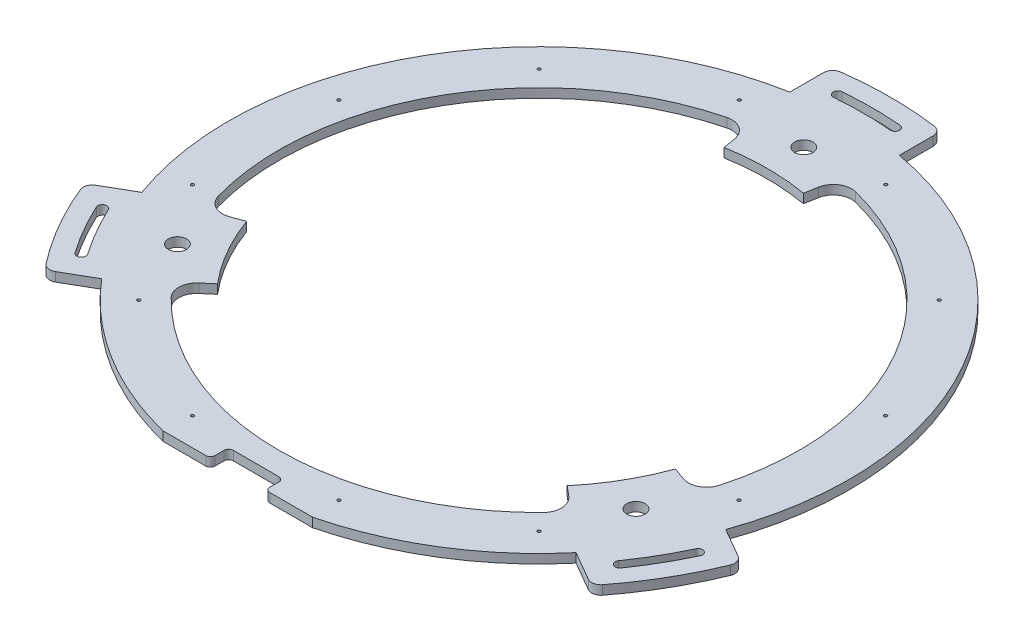
from build123d import *

# Parameters (mm, degrees)
SKETCH1_R                                       = 340
SKETCH1_R_2                                     = 250
BOSS_EXTRUDE1_DEPTH                             = 10
BOSS_EXTRUDE2_DEPTH                             = 10
CIRPATTERN1_COUNT                               = 3
CUT_EXTRUDE1_START                              = -10
CUT_EXTRUDE1_DEPTH                              = 10
CIRPATTERN2_COUNT                               = 3
CUT_EXTRUDE2_DEPTH                              = 10
SKETCH8_R                                       = 10
CUT_EXTRUDE3_DEPTH                              = 10
SKETCH9_W                                       = 60
SKETCH9_H                                       = 20
CUT_EXTRUDE4_DEPTH                              = 10
FILLET1_R                                       = 5
CSK_FOR_M3_FLAT_HEAD_MACHINE_SCREW1_D           = 3.4
CSK_FOR_M3_FLAT_HEAD_MACHINE_SCREW1_CSINK_D     = 6.3
CSK_FOR_M3_FLAT_HEAD_MACHINE_SCREW1_CSINK_ANGLE = 90


with BuildPart() as part:
    # Sketch1 → Boss-Extrude1 (new body)
    with BuildSketch(Plane(origin=(0, 0, 0), x_dir=(1, 0, 0), z_dir=(0, 1, 0))):
        Circle(SKETCH1_R)
        Circle(SKETCH1_R_2, mode=Mode.SUBTRACT)
    extrude(amount=BOSS_EXTRUDE1_DEPTH)

    # Sketch2 → Boss-Extrude2 (add)
    with BuildSketch(Plane.XZ):
        with BuildLine():
            Line((351.85982974, 133.864335114), (319.827534924, 115.37048108))
            ThreePointArc((319.827534924, 115.37048108), (294.448637287, 170), (259.827534924, 219.293529534))
            Line((259.827534924, 219.293529534), (291.85982974, 237.787383569))
            ThreePointArc((291.85982974, 237.787383569), (298.796843602, 238.937734879), (304.776091866, 235.237186318))
            ThreePointArc((304.776091866, 235.237186318), (333.419780457, 192.5), (356.109425199, 146.325244863))
            ThreePointArc((356.109425199, 146.325244863), (356.324570129, 139.29678969), (351.85982974, 133.864335114))
        make_face()
        with BuildLine():
            ThreePointArc((298.990496165, 209.355399268), (316.099272381, 182.5), (330.802342268, 154.255665535))
            ThreePointArc((330.802342268, 154.255665535), (328.383894642, 147.611035291), (321.739264398, 150.029482918))
            ThreePointArc((321.739264398, 150.029482918), (307.439018343, 177.5), (290.798975723, 203.619634905))
            ThreePointArc((290.798975723, 203.619634905), (292.026853762, 210.583277308), (298.990496165, 209.355399268))
        make_face(mode=Mode.SUBTRACT)
    boss_extrude2 = extrude(amount=-BOSS_EXTRUDE2_DEPTH)

    # CirPattern1: Boss-Extrude2 ×3 about axis
    cirpattern1_axis = Axis((0, 0, 0), (0, 1, 0))
    for i in range(1, CIRPATTERN1_COUNT):
        add(boss_extrude2.rotate(cirpattern1_axis, i * 360 / CIRPATTERN1_COUNT))

    # Sketch6 → Cut-Extrude1 (cut)
    with BuildSketch(Plane(origin=(0, 10, 0), x_dir=(1, 0, 0), z_dir=(0, 1, 0)).offset(CUT_EXTRUDE1_START)):
        with BuildLine():
            Line((234.923155198, -85.505035828), (248.308329746, -90.376840943))
            ThreePointArc((248.308329746, -90.376840943), (264.279563148, -89.377030612), (274.405240734, -76.985478228))
            ThreePointArc((274.405240734, -76.985478228), (246.817240076, 142.500000004), (70.53124049, 276.134648523))
            ThreePointArc((70.53124049, 276.134648523), (54.73700254, 273.561330695), (45.885524694, 260.229742004))
            Line((45.885524694, 260.229742004), (43.412044411, 246.201938254))
            ThreePointArc((43.412044411, 246.201938254), (191.511110778, 160.696902424), (250, 0))
            ThreePointArc((250, 0), (246.201938253, -43.412044415), (234.923155198, -85.505035828))
        make_face()
    cut_extrude1 = extrude(amount=CUT_EXTRUDE1_DEPTH, mode=Mode.SUBTRACT)

    # CirPattern2: Cut-Extrude1 ×3 about axis
    cirpattern2_axis = Axis((0, 0, 0), (0, 1, 0))
    for i in range(1, CIRPATTERN2_COUNT):
        add(cut_extrude1.rotate(cirpattern2_axis, i * 360 / CIRPATTERN2_COUNT), mode=Mode.SUBTRACT)

    # Sketch7 → Cut-Extrude2 (cut)
    with BuildSketch(Plane.XZ):
        with BuildLine():
            Line((-81.853527719, 330), (81.853527719, 330))
            ThreePointArc((81.853527719, 330), (0, 340), (-81.853527719, 330))
        make_face()
    extrude(amount=-CUT_EXTRUDE2_DEPTH, mode=Mode.SUBTRACT)

    # Sketch8 → Cut-Extrude3 (cut)
    with BuildSketch(Plane(origin=(0, 10, 0), x_dir=(1, 0, 0), z_dir=(0, 1, 0))):
        with Locations((0, 290)):
            Circle(SKETCH8_R)
        with Locations((251.147367097, -145)):
            Circle(SKETCH8_R)
        with Locations((-251.147367097, -145)):
            Circle(SKETCH8_R)
    extrude(amount=-CUT_EXTRUDE3_DEPTH, mode=Mode.SUBTRACT)

    # Sketch9 → Cut-Extrude4 (cut)
    with BuildSketch(Plane(origin=(0, 10, 0), x_dir=(1, 0, 0), z_dir=(0, 1, 0))):
        with Locations((0, -320)):
            Rectangle(SKETCH9_W, SKETCH9_H)
    extrude(amount=-CUT_EXTRUDE4_DEPTH, mode=Mode.SUBTRACT)

    # Fillet1
    fillet1_edges = [part.edges().sort_by_distance(p)[0] for p in [
        (30, 5, 330),
        (30, 5, 310),
        (-30, 5, 310),
        (-30, 5, 330),
    ]]
    fillet(fillet1_edges, radius=FILLET1_R)

    # CSK for M3 Flat Head Machine Screw1 (through all)
    with Locations(Plane(origin=(0, 40, 0), x_dir=(1, 0, 0), z_dir=(0, 1, 0))):
        with Locations((80.233903982, 299.43700615), (219.203102168, 219.203102168), (299.43700615, 80.233903982), (299.43700615, -80.233903982), (219.203102168, -219.203102168), (80.233903982, -299.43700615), (-80.233903982, -299.43700615), (-219.203102168, -219.203102168), (-299.43700615, -80.233903982), (-299.43700615, 80.233903982), (-219.203102168, 219.203102168), (-80.233903982, 299.43700615), (0, 0)):
            CounterSinkHole(CSK_FOR_M3_FLAT_HEAD_MACHINE_SCREW1_D / 2, CSK_FOR_M3_FLAT_HEAD_MACHINE_SCREW1_CSINK_D / 2, counter_sink_angle=CSK_FOR_M3_FLAT_HEAD_MACHINE_SCREW1_CSINK_ANGLE)


solid = part.part
